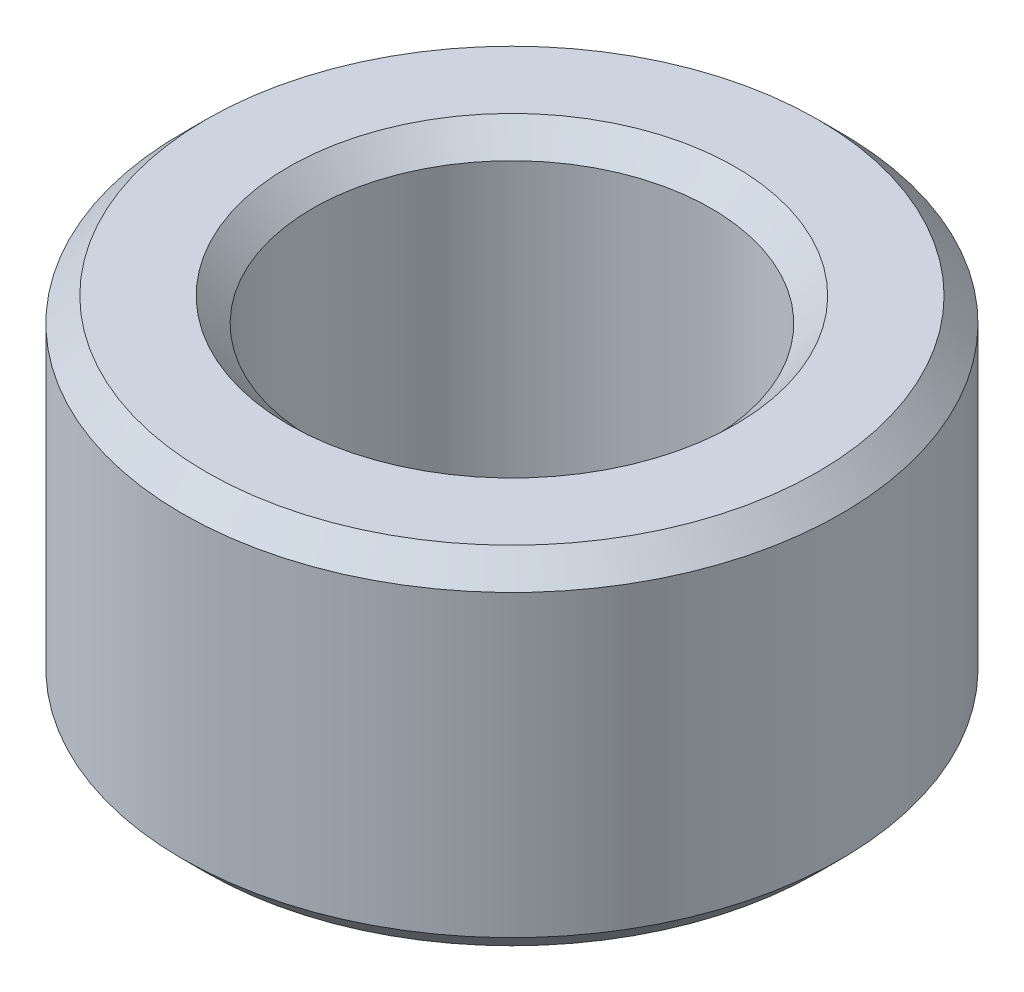
from build123d import *

# Parameters (mm, degrees)
SKETCH1_R           = 50
BOSS_EXTRUDE1_DEPTH = 52.628161225
SKETCH2_R           = 30.238369241
CUT_EXTRUDE1_DEPTH  = 89.146034249
CHAMFER1_SIZE       = 3.638260839


with BuildPart() as part:
    # Sketch1 → Boss-Extrude1 (new body)
    with BuildSketch(Plane(origin=(0, 0, 0), x_dir=(1, 0, 0), z_dir=(0, 1, 0))):
        Circle(SKETCH1_R)
    extrude(amount=BOSS_EXTRUDE1_DEPTH)

    # Sketch2 → Cut-Extrude1 (cut, through all)
    with BuildSketch(Plane(origin=(0, 0, 0), x_dir=(1, 0, 0), z_dir=(0, 1, 0))):
        Circle(SKETCH2_R)
    extrude(amount=CUT_EXTRUDE1_DEPTH, mode=Mode.SUBTRACT)

    # Chamfer1
    chamfer1_edges = [part.edges().sort_by_distance(p)[0] for p in [
        (-30.238369241, 52.628161225, 0),
        (-30.238369241, 0, 0),
        (-50, 0, 0),
        (-50, 52.628161225, 0),
    ]]
    chamfer(chamfer1_edges, length=CHAMFER1_SIZE)


solid = part.part
